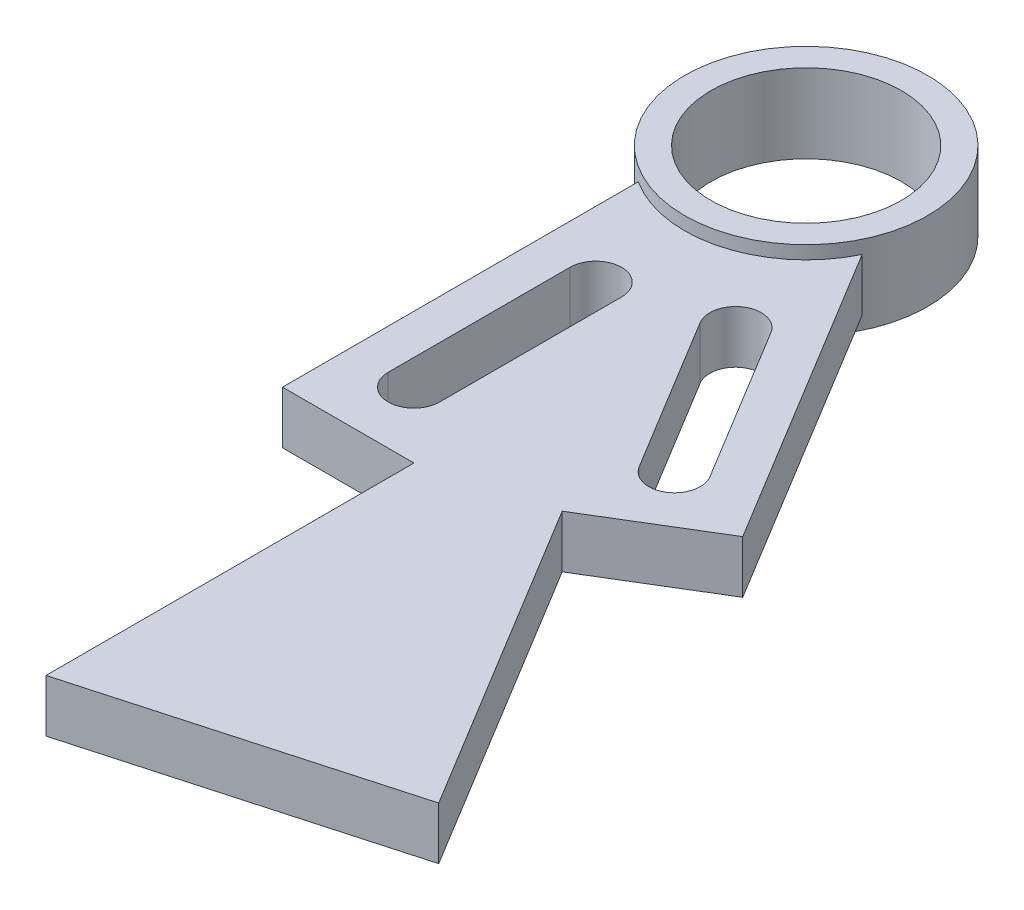
from build123d import *

# Parameters (mm, degrees)
SKETCH1_R             = 11.5062
BEARING_EXTRUDE_DEPTH = 4.7625
BOSS_EXTRUDE2_DEPTH   = 3.175


with BuildPart() as part:
    # Sketch1 → Bearing extrude (new, symmetric)
    with BuildSketch(Plane(origin=(0, 0, 0), x_dir=(1, 0, 0), z_dir=(0, 1, 0))):
        with BuildLine():
            ThreePointArc((14.6812, 0), (-7.035822924, 12.885450292), (-7.9375, -12.350454534))
            ThreePointArc((-7.9375, -12.350454534), (3.956954496, -14.137897459), (13.195425122, -6.435712026))
            ThreePointArc((13.195425122, -6.435712026), (14.304934616, -3.302495884), (14.6812, 0))
        make_face()
        Circle(SKETCH1_R, mode=Mode.SUBTRACT)
    extrude(amount=BEARING_EXTRUDE_DEPTH, both=True)

    # Sketch1<5> → Boss-Extrude2 (add, symmetric)
    with BuildSketch(Plane(origin=(0, 0, 0), x_dir=(1, 0, 0), z_dir=(0, 1, 0))):
        with BuildLine():
            Line((-7.9375, -12.350454534), (-7.9375, -55.3212))
            Line((-7.9375, -55.3212), (7.9375, -55.3212))
            Line((7.9375, -55.3212), (7.9375, -99.7712))
            Line((7.9375, -99.7712), (45.007158951, -89.396039615))
            Line((45.007158951, -89.396039615), (21.933071498, -51.404080094))
            Line((21.933071498, -51.404080094), (28.717349984, -47.283707335))
            Line((28.717349984, -47.283707335), (35.50162847, -43.163334575))
            Line((35.50162847, -43.163334575), (13.195425122, -6.435712026))
            ThreePointArc((13.195425122, -6.435712026), (3.956954496, -14.137897459), (-7.9375, -12.350454534))
        make_face()
        with BuildLine():
            ThreePointArc((3.1115, -47.3837), (0, -50.4952), (-3.1115, -47.3837))
            Line((-3.1115, -47.3837), (-3.1115, -25.4127))
            ThreePointArc((-3.1115, -25.4127), (0, -22.3012), (3.1115, -25.4127))
            Line((3.1115, -25.4127), (3.1115, -47.3837))
        make_face(mode=Mode.SUBTRACT)
        with BuildLine():
            ThreePointArc((27.256414391, -38.884242727), (27.619592339, -41.237825844), (26.212163346, -43.158866015))
            ThreePointArc((26.212163346, -43.158866015), (23.85858023, -43.522043963), (21.937540058, -42.114614971))
            Line((21.937540058, -42.114614971), (10.53234826, -23.335732122))
            ThreePointArc((10.53234826, -23.335732122), (11.576599305, -19.061108834), (15.851222593, -20.105359879))
            Line((15.851222593, -20.105359879), (27.256414391, -38.884242727))
        make_face(mode=Mode.SUBTRACT)
    extrude(amount=BOSS_EXTRUDE2_DEPTH, both=True)


solid = part.part
